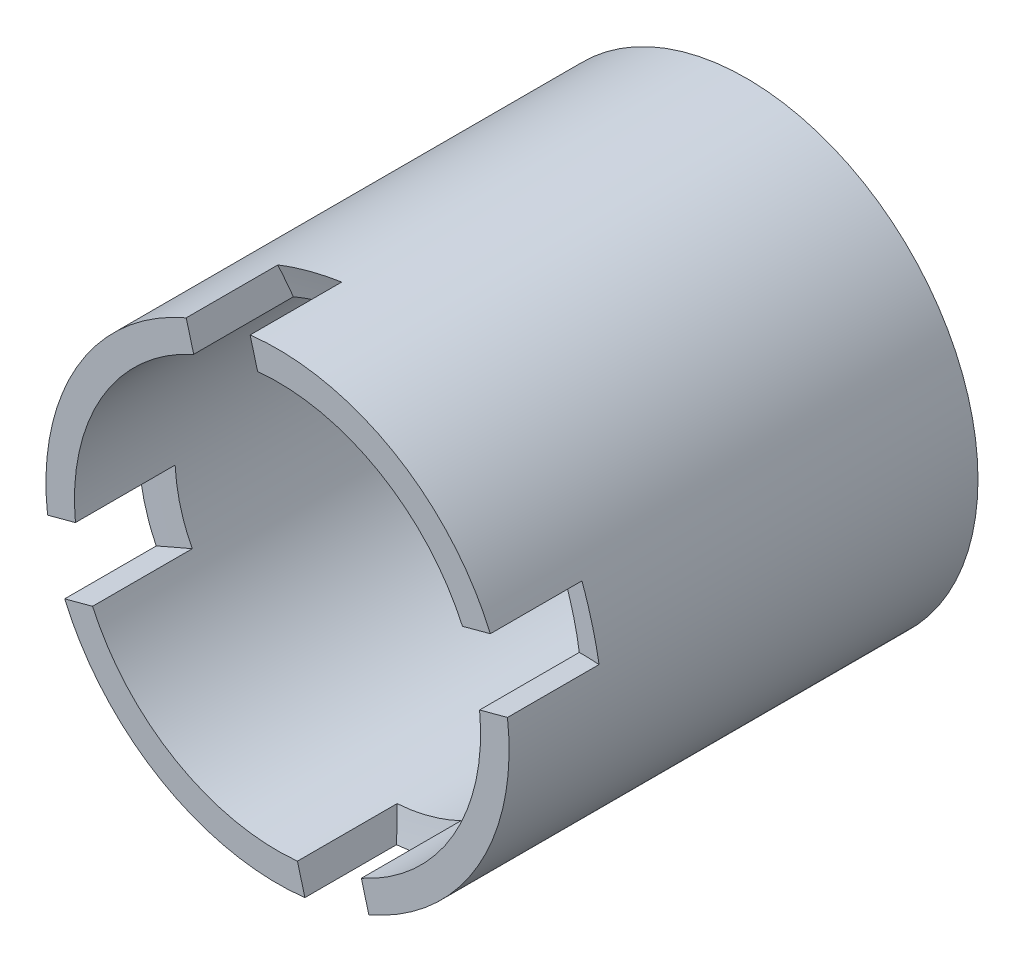
from build123d import *

# Parameters (mm, degrees)
SKETCH1_R           = 44.45
SKETCH1_R_2         = 38.9763
BOSS_EXTRUDE1_DEPTH = 90
CAVITY1_START       = -6.35
CAVITY1_DEPTH       = 12.7
CAVITY1_2_DEPTH     = 12.7


# Read off the part's stored shape, not the designer's step: Cavity1
with BuildPart() as part:
    # Sketch1 → Boss-Extrude1 (new body)
    with BuildSketch(Plane.XY):
        with Locations(Location((0, 0, 0), (0, 0, 180))):
            Circle(SKETCH1_R)
        with Locations(Location((0, 0, 0), (0, 0, 180))):
            Circle(SKETCH1_R_2, mode=Mode.SUBTRACT)
    extrude(amount=BOSS_EXTRUDE1_DEPTH)

    # Cavity1 outline → Cavity1 (cut)
    with BuildSketch(Plane(origin=(0, 0, 0), x_dir=(-0.258888878578149, 0.9659071117600018, 0), z_dir=(0.9659071117600018, 0.25888887857814896, 0)).offset(CAVITY1_START)):
        with BuildLine():
            ThreePointArc((38.455551767, 70.863594779), (41.461594511, 71.680385005), (44.450315107, 72.558444487))
            Line((44.450315107, 72.558444487), (46, 73.030985488))
            Line((46, 73.030985488), (46, 90))
            Line((46, 90), (-46, 90))
            Line((-46, 90), (-46, 73.030985488))
            Line((-46, 73.030985488), (-44.450315107, 72.558444487))
            ThreePointArc((-44.450315107, 72.558444487), (-41.461594511, 71.680385005), (-38.455551767, 70.863594779))
            Line((-38.455551767, 70.863594779), (-31.309084293, 69))
            Line((-31.309084293, 69), (31.309084293, 69))
            Line((31.309084293, 69), (38.455551767, 70.863594779))
        make_face()
    extrude(amount=CAVITY1_DEPTH, mode=Mode.SUBTRACT)

    # Cavity1 2 outline → Cavity1 2 (cut)
    with BuildSketch(Plane(origin=(0, 0, 0), x_dir=(0.9659071117600018, 0.258888878578149, 0), z_dir=(0.25888887857814896, -0.9659071117600018, 0)).offset(CAVITY1_START)):
        with BuildLine():
            ThreePointArc((38.455551767, 70.863594779), (41.461594511, 71.680385005), (44.450315107, 72.558444487))
            Line((44.450315107, 72.558444487), (46, 73.030985488))
            Line((46, 73.030985488), (46, 90))
            Line((46, 90), (-46, 90))
            Line((-46, 90), (-46, 73.030985488))
            Line((-46, 73.030985488), (-44.450315107, 72.558444487))
            ThreePointArc((-44.450315107, 72.558444487), (-41.461594511, 71.680385005), (-38.455551767, 70.863594779))
            Line((-38.455551767, 70.863594779), (-31.309084293, 69))
            Line((-31.309084293, 69), (31.309084293, 69))
            Line((31.309084293, 69), (38.455551767, 70.863594779))
        make_face()
    extrude(amount=CAVITY1_2_DEPTH, mode=Mode.SUBTRACT)


solid = part.part
